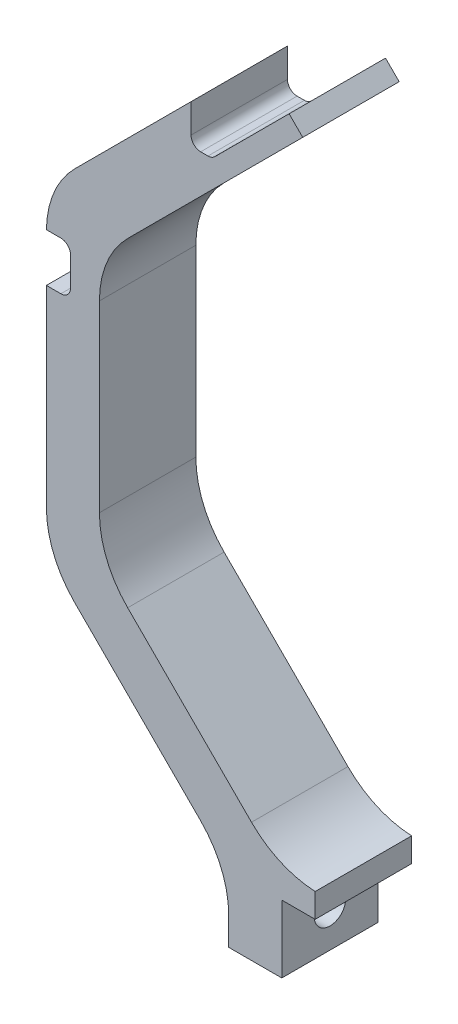
from build123d import *

# Parameters (mm, degrees)
ESTRUSIONE_ESTRUSIONE1_DEPTH = 5
SCHIZZO2_R                   = 2.5
TAGLIO_ESTRUSIONE2_DEPTH     = 3.5
SCHIZZO3_R                   = 1.625
TAGLIO_ESTRUSIONE3_DEPTH     = 10
RACCORDO1_R                  = 10
SCHIZZO4_W                   = 2.5
SCHIZZO4_H                   = 5
TAGLIO_ESTRUSIONE4_DEPTH     = 10
RACCORDO2_R                  = 1
SCHIZZO5_R                   = 1.625
TAGLIO_ESTRUSIONE5_DEPTH     = 10


with BuildPart() as part:
    # Schizzo1 → Estrusione-Estrusione1 (new, symmetric)
    with BuildSketch(Plane.XY):
        Polygon((-13.891157033, -0.6), (-19.391157033, -0.6), (-19.391157033, 6.4), (-38.302699765, 25.311542732), (-38.302699765, 58.4), (-23.302699765, 73.4), (-23.302699765, 69.4), (-21.131126889, 69.4), (-13.131126889, 77.4), (-11.716913327, 75.985786438), (-32.802699765, 54.9), (-32.802699765, 27.589717325), (-14.11298244, 8.9), (-10.427699765, 8.9), (-10.427699765, 6.4), (-13.891157033, 6.4), align=None)
    extrude(amount=ESTRUSIONE_ESTRUSIONE1_DEPTH, both=True)

    # Schizzo2 → Taglio-Estrusione2 (cut)
    with BuildSketch(Plane.ZY.offset(19.391157033)):
        with Locations(Location((0, 3.2, 0), (0, 0, 270))):
            Circle(SCHIZZO2_R)
    extrude(amount=-TAGLIO_ESTRUSIONE2_DEPTH, mode=Mode.SUBTRACT)

    # Schizzo3 → Taglio-Estrusione3 (cut)
    with BuildSketch(Plane.ZY.offset(19.391157033)):
        with Locations(Location((0, 3.2, 0), (0, 0, 270))):
            Circle(SCHIZZO3_R)
    extrude(amount=-TAGLIO_ESTRUSIONE3_DEPTH, mode=Mode.SUBTRACT)

    # Raccordo1
    # the kernel refuses this fillet: 10 mm, written as the material it adds along each edge
    with BuildSketch(Plane(origin=(-19.391157033, 6.4, 5), x_dir=(0, -1, 0), z_dir=(0, 0, -1))) as raccordo1_piece_1_section:
        with BuildLine():
            CenterArc((RACCORDO1_R * 0.414213562373, RACCORDO1_R), RACCORDO1_R, 225, 45)
            Line((-RACCORDO1_R * 0.292893218813, RACCORDO1_R * 0.292893218813), (0, 0))
            Line((0, 0), (RACCORDO1_R * 0.414213562373, 0))
        make_face()
    raccordo1_piece_1 = extrude(amount=10, mode=Mode.PRIVATE)
    raccordo1_piece_1 = raccordo1_piece_1 - Plane(origin=(-19.391157033, 3.2, 0), x_dir=(0, -1, 0), z_dir=(-1, 0, 0)) * Cylinder(2.5, 37, mode=Mode.PRIVATE)
    add(raccordo1_piece_1)
    with BuildSketch(Plane(origin=(-14.11298244, 8.9, 5), x_dir=(-0.7071067811865495, 0.7071067811865456, 0), z_dir=(0, 0, -1))) as raccordo1_piece_2:
        with BuildLine():
            CenterArc((4.126652993, 10), RACCORDO1_R, 227.681279823, 42.318720177)
            Line((-2.60588837, 2.60588837), (0, 0))
            Line((0, 0), (4.126652993, 0))
        make_face()
    extrude(amount=10)
    with BuildSketch(Plane(origin=(-32.802699765, 27.589717325, 5), x_dir=(0, 1, 0), z_dir=(0, 0, -1)), Plane(origin=(-32.802699765, 54.9, 5), x_dir=(0.7071067811865458, 0.7071067811865492, 0), z_dir=(0, 0, -1))) as raccordo1_piece_3:
        with BuildLine():
            CenterArc((RACCORDO1_R * 0.414213562373, RACCORDO1_R), RACCORDO1_R, 225, 45)
            Line((-RACCORDO1_R * 0.292893218813, RACCORDO1_R * 0.292893218813), (0, 0))
            Line((0, 0), (RACCORDO1_R * 0.414213562373, 0))
        make_face()
    extrude(amount=10)
    # the kernel refuses this fillet: 10 mm, written as the material it takes off along each edge
    with BuildSketch(Plane(origin=(-38.302699765, 25.311542732, 15.355339059), x_dir=(0.7071067811865497, -0.7071067811865454, 0), z_dir=(0, 0, -1)), Plane(origin=(-38.302699765, 58.4, 15.355339059), x_dir=(0, -1, 0), z_dir=(0, 0, -1))) as raccordo1_2_piece_1:
        with BuildLine():
            CenterArc((RACCORDO1_R * 0.414213562373, -RACCORDO1_R), RACCORDO1_R, 90, 45)
            Line((-RACCORDO1_R * 0.292893218813, -RACCORDO1_R * 0.292893218813), (0, 0))
            Line((0, 0), (RACCORDO1_R * 0.414213562373, 0))
        make_face()
    extrude(amount=30.710678119, mode=Mode.SUBTRACT)

    # Schizzo4 → Taglio-Estrusione4 (cut)
    with BuildSketch(Plane(origin=(0, 0, -5), x_dir=(-1, 0, 0), z_dir=(0, 0, -1))):
        with Locations((37.052699765, 51.9)):
            Rectangle(SCHIZZO4_W, SCHIZZO4_H)
    extrude(amount=-TAGLIO_ESTRUSIONE4_DEPTH, mode=Mode.SUBTRACT)

    # Raccordo2
    raccordo2_edges = [part.edges().sort_by_distance(p)[0] for p in [
        (-35.802699765, 49.4, 0),
        (-35.802699765, 54.4, 0),
        (-23.302699765, 69.4, 0),
        (-21.131126889, 69.4, 0),
    ]]
    fillet(raccordo2_edges, radius=RACCORDO2_R)

    # Schizzo5 → Taglio-Estrusione5 (cut)
    with BuildSketch(Plane(origin=(-43.851349882, 43.851349882, 0), x_dir=(0, 0, -1), z_dir=(0.707106781186549, -0.707106781186546, 0))):
        with Locations(Location((0, 41.444955996, 0), (0, 0, 90))):
            Circle(SCHIZZO5_R)
    extrude(amount=-TAGLIO_ESTRUSIONE5_DEPTH, mode=Mode.SUBTRACT)


solid = part.part
